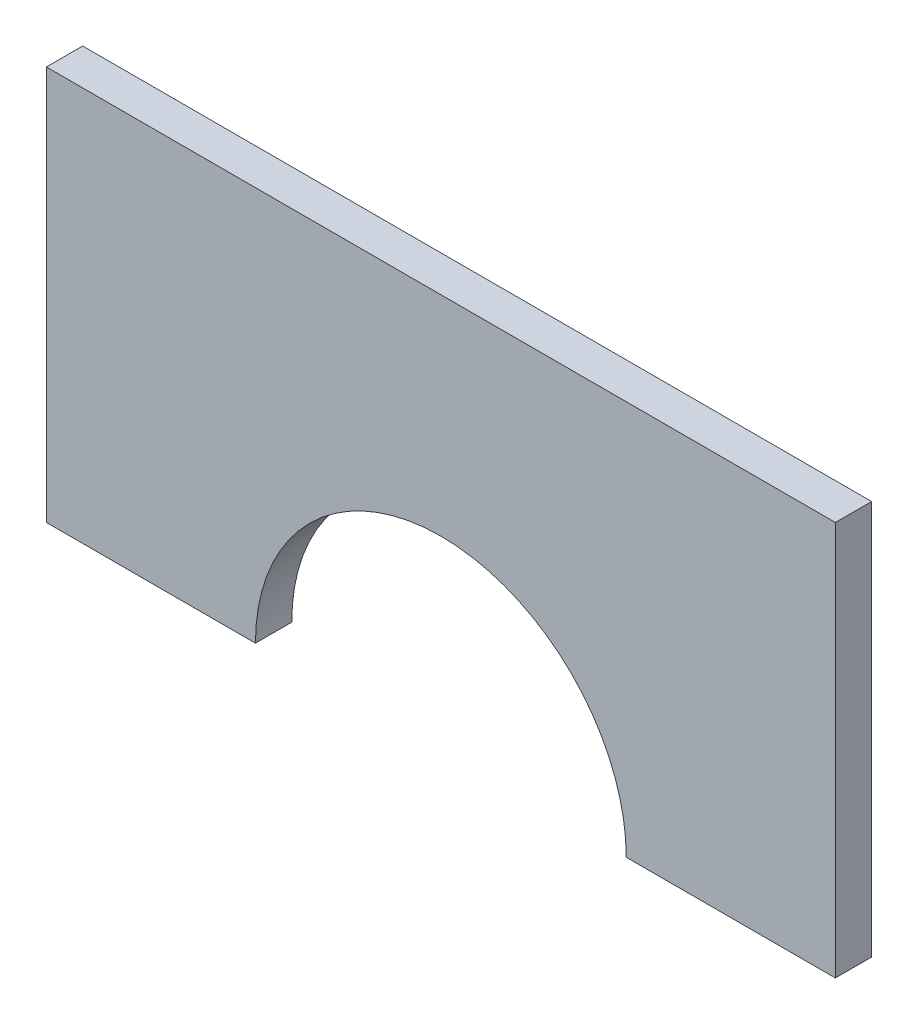
from build123d import *

# Parameters (mm, degrees)
BOSS_EXTRU_1_DEPTH = 4.6


with BuildPart() as part:
    # Esquisse1 → Boss.-Extru.1 (new body)
    with BuildSketch(Plane.XY):
        with BuildLine():
            Line((55.828319543, 36.150115875), (-44.171680457, 36.150115875))
            Line((-44.171680457, 36.150115875), (-44.171680457, -13.849884125))
            Line((-44.171680457, -13.849884125), (-17.671680457, -13.849884125))
            ThreePointArc((-17.671680457, -13.849884125), (5.828319543, 9.650115875), (29.328319543, -13.849884125))
            Line((29.328319543, -13.849884125), (55.828319543, -13.849884125))
            Line((55.828319543, -13.849884125), (55.828319543, 36.150115875))
        make_face()
    extrude(amount=BOSS_EXTRU_1_DEPTH)


solid = part.part
